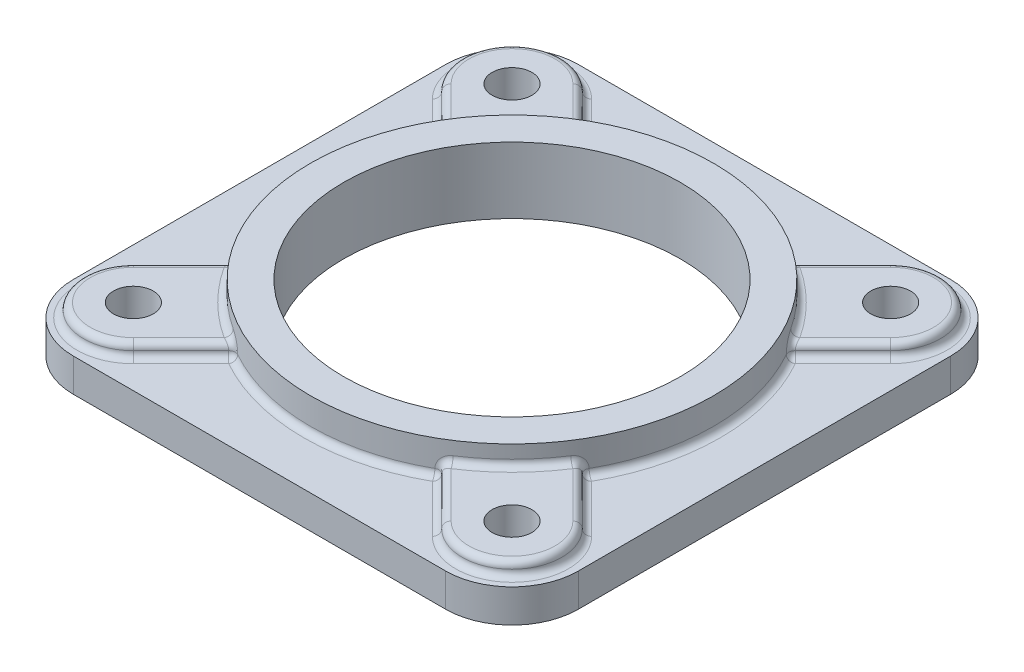
from build123d import *

# Parameters (mm, degrees)
SKETCH1_W             = 76.2
SKETCH1_H             = 76.2
SKETCH1_R             = 25.4
BOSS_EXTRUDE1_DEPTH   = 5
SKETCH2_R             = 30.4
SKETCH2_R_2           = 25.4
BOSS_EXTRUDE2_DEPTH   = 5
FILLET2_R             = 10
BOSS_EXTRUDE3_DEPTH   = 2
CIRPATTERN1_COUNT     = 4
F_6_0MM_DOWEL_HOLE1_D = 6
FILLET1_R             = 1


with BuildPart() as part:
    # Sketch1 → Boss-Extrude1 (new body)
    with BuildSketch(Plane(origin=(0, 0, 0), x_dir=(1, 0, 0), z_dir=(0, 1, 0))):
        Rectangle(SKETCH1_W, SKETCH1_H)
        with Locations(Location((0, 0, 0), (0, 0, 270))):
            Circle(SKETCH1_R, mode=Mode.SUBTRACT)
    extrude(amount=BOSS_EXTRUDE1_DEPTH)

    # Sketch2 → Boss-Extrude2 (add)
    with BuildSketch(Plane(origin=(0, 5, 0), x_dir=(1, 0, 0), z_dir=(0, 1, 0))):
        with Locations(Location((0, 0, 0), (0, 0, 270))):
            Circle(SKETCH2_R)
        with Locations(Location((0, 0, 0), (0, 0, 270))):
            Circle(SKETCH2_R_2, mode=Mode.SUBTRACT)
    extrude(amount=BOSS_EXTRUDE2_DEPTH)

    # Fillet2
    fillet2_edges = [part.edges().sort_by_distance(p)[0] for p in [
        (-38.1, 2.5, -38.1),
        (38.1, 2.5, -38.1),
        (38.1, 2.5, 38.1),
        (-38.1, 2.5, 38.1),
    ]]
    fillet(fillet2_edges, radius=FILLET2_R)

    # Sketch5 → Boss-Extrude3 (add)
    with BuildSketch(Plane(origin=(0, 5, 0), x_dir=(1, 0, 0), z_dir=(0, 1, 0))):
        with BuildLine():
            Line((-26.134887452, 15.528285735), (-33.870414819, 23.263813101))
            ThreePointArc((-33.870414819, 23.263813101), (-33.870414819, 33.870414819), (-23.263813101, 33.870414819))
            Line((-23.263813101, 33.870414819), (-15.528285735, 26.134887452))
            ThreePointArc((-15.528285735, 26.134887452), (-21.496046148, 21.496046148), (-26.134887452, 15.528285735))
        make_face()
    boss_extrude3 = extrude(amount=BOSS_EXTRUDE3_DEPTH)

    # CirPattern1: Boss-Extrude3 ×4 about axis
    cirpattern1_axis = Axis((0, 0, 0), (0, 1, 0))
    for i in range(1, CIRPATTERN1_COUNT):
        add(boss_extrude3.rotate(cirpattern1_axis, i * 360 / CIRPATTERN1_COUNT))

    # Ø6.0mm Dowel Hole1 (through all)
    with Locations(Plane(origin=(0, 7, 0), x_dir=(1, 0, 0), z_dir=(0, 1, 0))):
        with Locations((-28.56711396, -28.56711396), (28.56711396, -28.56711396), (28.56711396, 28.56711396), (-28.56711396, 28.56711396)):
            Hole(F_6_0MM_DOWEL_HOLE1_D / 2)

    # Fillet1
    fillet1_edges = [part.edges().sort_by_distance(p)[0] for p in [
        (-30.4, 5, 0),
        (-26.134887452, 6, -15.528285735),
        (-19.396049418, 5, -30.002651136),
        (-15.528285735, 6, -26.134887452),
        (-33.870414819, 5, -33.870414819),
        (-23.263813101, 6, -33.870414819),
        (-30.002651136, 5, -19.396049418),
        (-33.870414819, 6, -23.263813101),
        (-21.496046148, 7, -21.496046148),
        (-19.396049418, 7, -30.002651136),
        (-33.870414819, 7, -33.870414819),
        (-30.002651136, 7, -19.396049418),
        (8.05168993, 5, 29.3143359),
        (-15.528285735, 6, 26.134887452),
        (-30.002651136, 5, 19.396049418),
        (-26.134887452, 6, 15.528285735),
        (-33.870414819, 5, 33.870414819),
        (-33.870414819, 6, 23.263813101),
        (-19.396049418, 5, 30.002651136),
        (-23.263813101, 6, 33.870414819),
        (-21.496046148, 7, 21.496046148),
        (-30.002651136, 7, 19.396049418),
        (-33.870414819, 7, 33.870414819),
        (-19.396049418, 7, 30.002651136),
        (30.4, 5, 0),
        (26.134887452, 6, 15.528285735),
        (19.396049418, 5, 30.002651136),
        (15.528285735, 6, 26.134887452),
        (33.870414819, 5, 33.870414819),
        (23.263813101, 6, 33.870414819),
        (30.002651136, 5, 19.396049418),
        (33.870414819, 6, 23.263813101),
        (21.496046148, 7, 21.496046148),
        (19.396049418, 7, 30.002651136),
        (33.870414819, 7, 33.870414819),
        (30.002651136, 7, 19.396049418),
        (0, 5, -30.4),
        (15.528285735, 6, -26.134887452),
        (30.002651136, 5, -19.396049418),
        (26.134887452, 6, -15.528285735),
        (33.870414819, 5, -33.870414819),
        (33.870414819, 6, -23.263813101),
        (19.396049418, 5, -30.002651136),
        (23.263813101, 6, -33.870414819),
        (21.496046148, 7, -21.496046148),
        (30.002651136, 7, -19.396049418),
        (33.870414819, 7, -33.870414819),
        (19.396049418, 7, -30.002651136),
    ]]
    fillet(fillet1_edges, radius=FILLET1_R - 0.0001)  # a hair under: the kernel refuses the full size


solid = part.part
